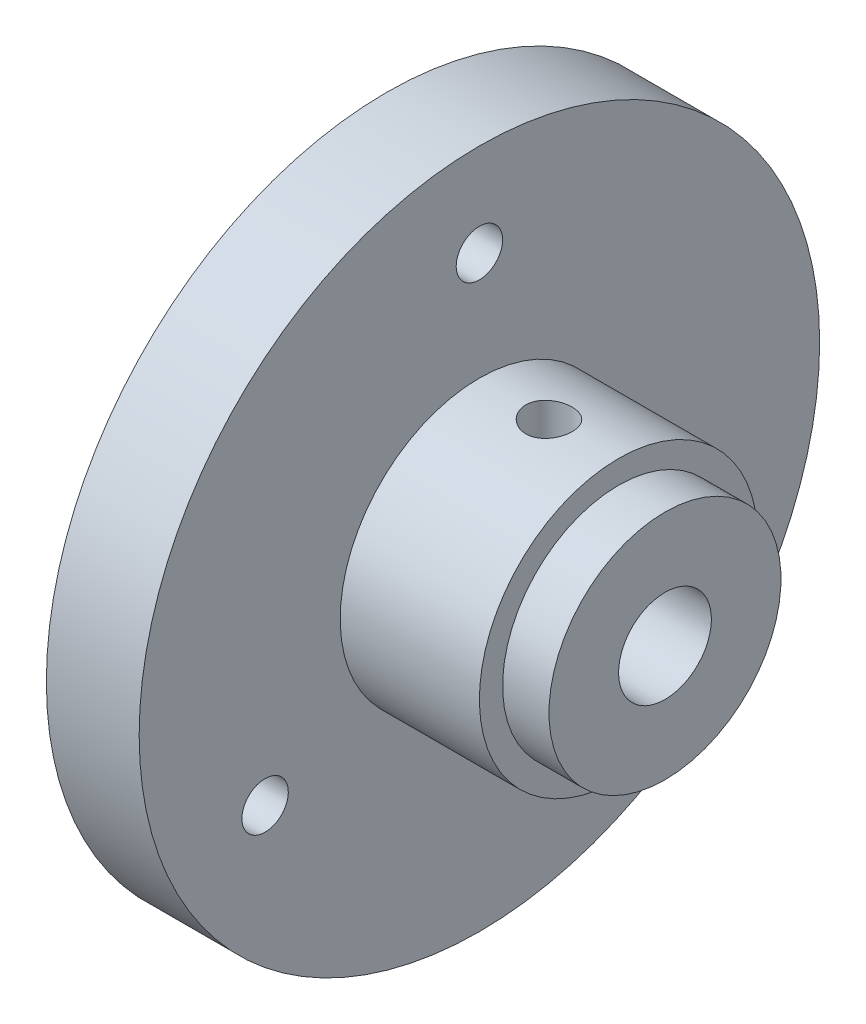
from build123d import *

# Parameters (mm, degrees)
ESQUISSE2_R             = 1.5
ENL_V_MAT_EXTRU_1_DEPTH = 34.346664001
ENL_V_MAT_EXTRU_2_REACH = 44.059
ESQUISSE3_R             = 1.5


with BuildPart() as part:
    # Esquisse1 → Révolution1 (revolve)
    with BuildSketch(Plane.XY):
        Polygon((0, 3), (-18, 3), (-18, 22), (-12, 22), (-12, 9), (-3, 9), (-3, 7.5), (0, 7.5), align=None)
    revolve(axis=Axis((0, 0, 0), (-1, 0, 0)))

    # Esquisse2 → Enlèv. mat.-Extru.1 (cut, through all)
    with BuildSketch(Plane(origin=(-12, 0, 0), x_dir=(0, 0, -1), z_dir=(1, 0, 0))):
        with Locations((0, 16)):
            Circle(ESQUISSE2_R)
        with Locations((13.856406461, -8)):
            Circle(ESQUISSE2_R)
        with Locations((-13.856406461, -8)):
            Circle(ESQUISSE2_R)
    extrude(amount=-ENL_V_MAT_EXTRU_1_DEPTH, mode=Mode.SUBTRACT)

    # Esquisse3 → Enlèv. mat.-Extru.2 (cut, up to next)
    with BuildSketch(Plane(origin=(0, 9, 0), x_dir=(1, 0, 0), z_dir=(0, 1, 0)), mode=Mode.PRIVATE) as enl_v_mat_extru_2_sk1:
        with Locations((-7.5, 0)):
            Circle(ESQUISSE3_R)
    enl_v_mat_extru_2_tool1 = extrude(enl_v_mat_extru_2_sk1.sketch, amount=-ENL_V_MAT_EXTRU_2_REACH, mode=Mode.PRIVATE) & part.part
    add(enl_v_mat_extru_2_tool1.solids().sort_by_distance((-7.5, 9, 0))[0], mode=Mode.SUBTRACT)


solid = part.part
